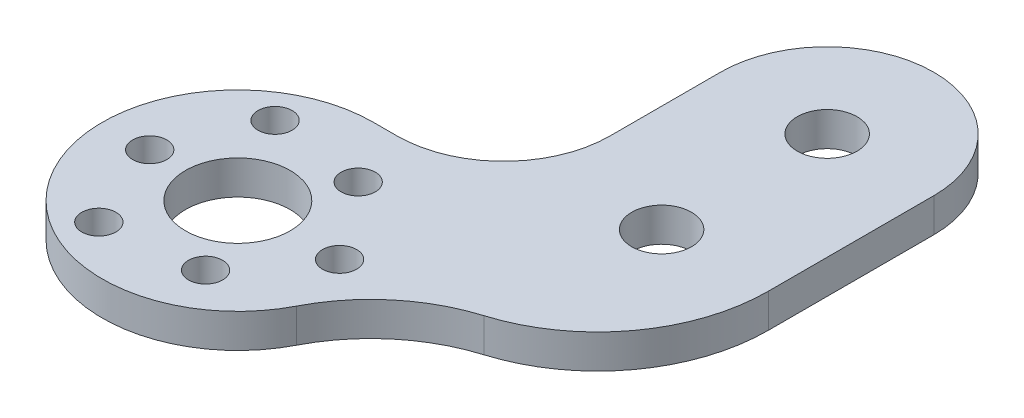
from build123d import *

# Parameters (mm, degrees)
SKETCH1_R           = 2.8
SKETCH1_R_2         = 4.9
SKETCH1_R_3         = 1.6
BOSS_EXTRUDE1_DEPTH = 3.175
CUT_EXTRUDE1_REACH  = 55.802
SKETCH3_R           = 1.6


with BuildPart() as part:
    # Sketch1 → Boss-Extrude1 (new body)
    with BuildSketch(Plane(origin=(0, 0, 0), x_dir=(1, 0, 0), z_dir=(0, 1, 0))):
        with BuildLine():
            Line((12.18, 33), (12.18, 22.7))
            ThreePointArc((12.18, 22.7), (9.251067812, 15.628932188), (2.18, 12.7))
            Line((2.18, 12.7), (0, 12.7))
            ThreePointArc((0, 12.7), (-10.837940978, -6.620350093), (11.29936434, -5.797789709))
            ThreePointArc((11.29936434, -5.797789709), (15.26781807, -0.83060398), (20.857391991, 2.198954148))
            ThreePointArc((20.857391991, 2.198954148), (29.041537075, 7.982602032), (32.18, 17.5))
            Line((32.18, 17.5), (32.18, 33))
            ThreePointArc((32.18, 33), (22.18, 43), (12.18, 33))
        make_face()
        with Locations((22.18, 17.5)):
            Circle(SKETCH1_R, mode=Mode.SUBTRACT)
        with Locations((22.18, 33)):
            Circle(SKETCH1_R, mode=Mode.SUBTRACT)
        Circle(SKETCH1_R_2, mode=Mode.SUBTRACT)
        with Locations((-8.25, 0)):
            Circle(SKETCH1_R_3, mode=Mode.SUBTRACT)
        with Locations((4.125, 7.144709581)):
            Circle(SKETCH1_R_3, mode=Mode.SUBTRACT)
        with Locations((4.125, -7.144709581)):
            Circle(SKETCH1_R_3, mode=Mode.SUBTRACT)
    extrude(amount=BOSS_EXTRUDE1_DEPTH)

    # Sketch3 → Cut-Extrude1 (cut, up to next)
    with BuildSketch(Plane(origin=(0, 3.175, 0), x_dir=(1, 0, 0), z_dir=(0, 1, 0)), mode=Mode.PRIVATE) as cut_extrude1_sk1:
        with Locations((9.526279442, 0)):
            Circle(SKETCH3_R)
    cut_extrude1_tool1 = extrude(cut_extrude1_sk1.sketch, amount=-CUT_EXTRUDE1_REACH, mode=Mode.PRIVATE) & part.part
    # Sketch3 → Cut-Extrude1 (cut, up to next)
    with BuildSketch(Plane(origin=(0, 3.175, 0), x_dir=(1, 0, 0), z_dir=(0, 1, 0)), mode=Mode.PRIVATE) as cut_extrude1_sk2:
        with Locations((-4.763139721, -8.25)):
            Circle(SKETCH3_R)
    cut_extrude1_tool2 = extrude(cut_extrude1_sk2.sketch, amount=-CUT_EXTRUDE1_REACH, mode=Mode.PRIVATE) & part.part
    # Sketch3 → Cut-Extrude1 (cut, up to next)
    with BuildSketch(Plane(origin=(0, 3.175, 0), x_dir=(1, 0, 0), z_dir=(0, 1, 0)), mode=Mode.PRIVATE) as cut_extrude1_sk3:
        with Locations((-4.763139721, 8.25)):
            Circle(SKETCH3_R)
    cut_extrude1_tool3 = extrude(cut_extrude1_sk3.sketch, amount=-CUT_EXTRUDE1_REACH, mode=Mode.PRIVATE) & part.part
    add(cut_extrude1_tool1.solids().sort_by_distance((9.526279, 3.175, 0))[0], mode=Mode.SUBTRACT)
    add(cut_extrude1_tool2.solids().sort_by_distance((-4.76314, 3.175, 8.25))[0], mode=Mode.SUBTRACT)
    add(cut_extrude1_tool3.solids().sort_by_distance((-4.76314, 3.175, -8.25))[0], mode=Mode.SUBTRACT)


solid = part.part
